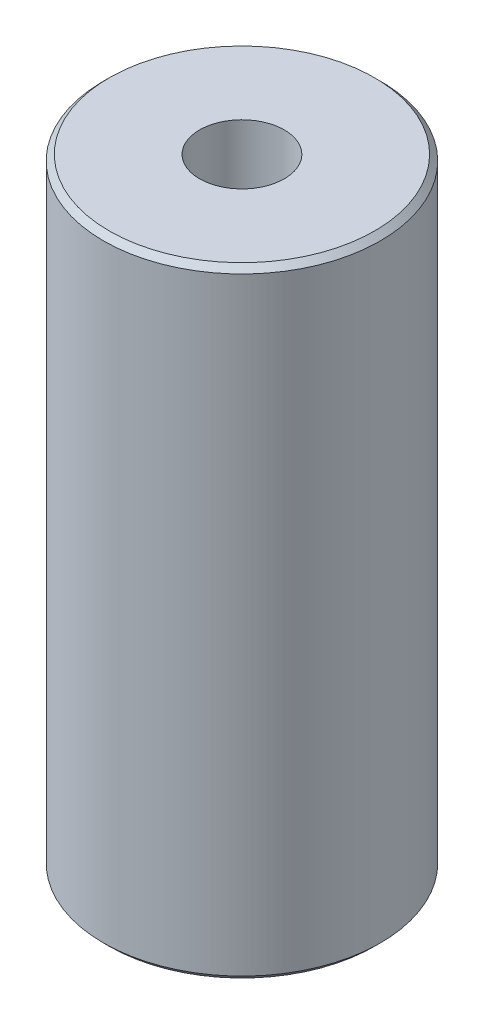
from build123d import *

# Parameters (mm, degrees)
SKETCH1_R           = 32.5
BOSS_EXTRUDE1_DEPTH = 145.436498102
SKETCH2_R           = 9.953458313
CUT_EXTRUDE1_DEPTH  = 153.526309141
CHAMFER1_SIZE       = 1.347384967


with BuildPart() as part:
    # Sketch1 → Boss-Extrude1 (new body)
    with BuildSketch(Plane(origin=(0, 0, 0), x_dir=(1, 0, 0), z_dir=(0, 1, 0))):
        Circle(SKETCH1_R)
    extrude(amount=BOSS_EXTRUDE1_DEPTH)

    # Sketch2 → Cut-Extrude1 (cut, through all)
    with BuildSketch(Plane(origin=(0, 0, 0), x_dir=(1, 0, 0), z_dir=(0, 1, 0))):
        Circle(SKETCH2_R)
    extrude(amount=CUT_EXTRUDE1_DEPTH, mode=Mode.SUBTRACT)

    # Chamfer1
    chamfer1_edges = [part.edges().sort_by_distance(p)[0] for p in [
        (-32.5, 145.436498102, 0),
        (-32.5, 0, 0),
    ]]
    chamfer(chamfer1_edges, length=CHAMFER1_SIZE)


solid = part.part
